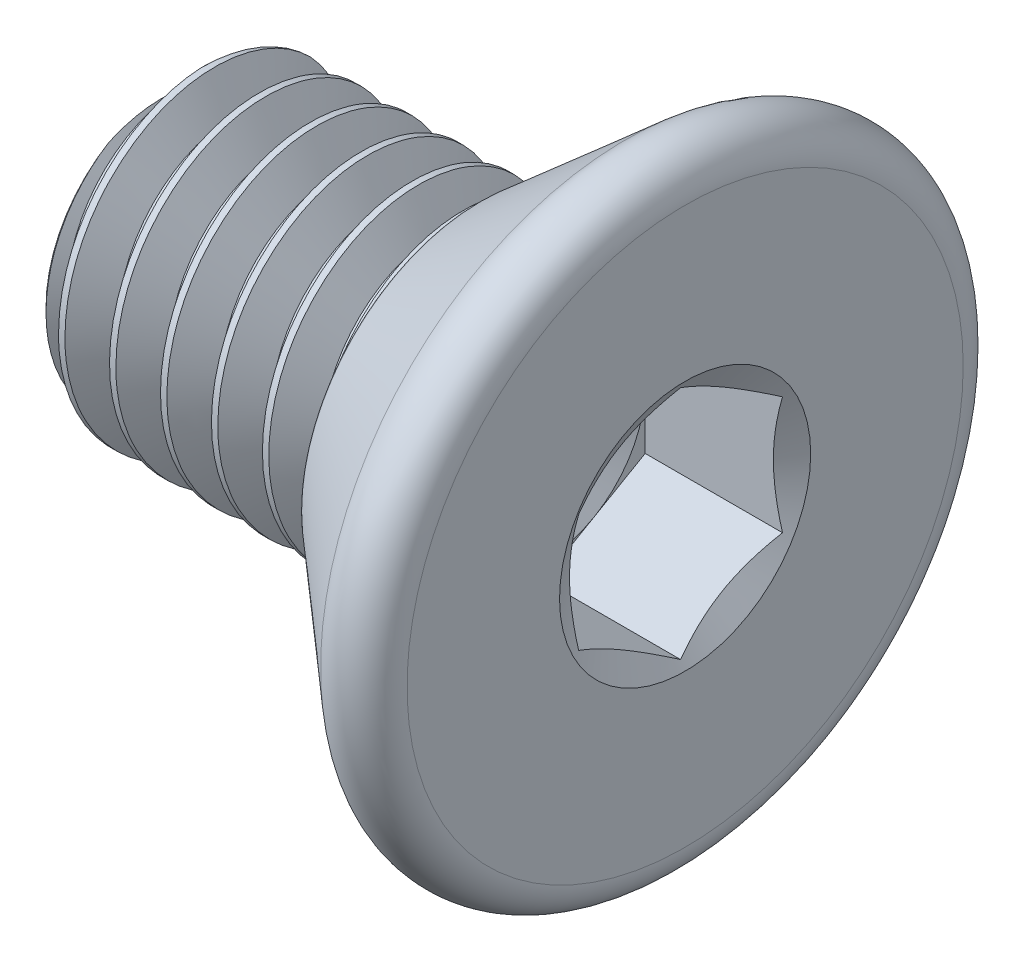
from build123d import *

# Parameters (mm, degrees)
CUT_EXTRUDE1_DEPTH = 2.2098
CUT_SWEEP1_PITCH   = 0.79375
CUT_SWEEP1_TO      = 4.7117


with BuildPart() as part:
    # Sketch3 → Revolve1 (revolve)
    with BuildSketch(Plane.XY, mode=Mode.PRIVATE) as revolve1_sk:
        with BuildLine():
            Line((-3.571875, 2.413), (-3.96875, 2.016125))
            Line((-3.96875, 2.016125), (-3.96875, 0))
            Line((-3.96875, 0), (3.96875, 0))
            Line((3.96875, 0), (3.96875, 4.330768235))
            ThreePointArc((3.96875, 4.330768235), (3.641720522, 4.839192502), (3.043457216, 4.752448451))
            Line((3.043457216, 4.752448451), (0.790519991, 2.794))
            ThreePointArc((0.790519991, 2.794), (0.75540313, 2.74697282), (0.74295, 2.689617182))
            Line((0.74295, 2.689617182), (0.74295, 2.551308591))
            ThreePointArc((0.74295, 2.551308591), (0.702440352, 2.453509648), (0.604641409, 2.413))
            Line((0.604641409, 2.413), (-3.571875, 2.413))
        make_face()
    revolve(revolve1_sk.sketch.rotate(Axis((3.96875, 0, 0), (-1, 0, 0)), 90), axis=Axis((3.96875, 0, 0), (-1, 0, 0)))

    # Sketch4 → Cut-Extrude1 (cut)
    with BuildSketch(Plane(origin=(3.96875, 0, 0), x_dir=(0, 0, -1), z_dir=(1, 0, 0))):
        Polygon((0, 1.833087105), (-1.5875, 0.916543552), (-1.5875, -0.916543552), (0, -1.833087105), (1.5875, -0.916543552), (1.5875, 0.916543552), align=None)
    extrude(amount=-CUT_EXTRUDE1_DEPTH, mode=Mode.SUBTRACT)

    # Cut-Extrude2 cone 1 section (through the dimple's axis) → Cut-Extrude2 (revolve, cut)
    with BuildSketch(Plane(origin=(3.96875, 0, 0), x_dir=(0, 0, -1), z_dir=(0, 1, 0))):
        Polygon((0, 0), (1.955880657, 0), (0, 1.129228224), align=None)
    revolve(axis=Axis((3.96875, 0, 0), (-1, 0, 0)), mode=Mode.SUBTRACT)

    # Cut-Extrude3 cone 1 section (through the dimple's axis) → Cut-Extrude3 (revolve, cut)
    with BuildSketch(Plane(origin=(1.75895, 0, 0), x_dir=(0, 0, -1), z_dir=(0, 1, 0))):
        Polygon((0, 0), (1.5875, 0), (0, 0.916543552), align=None)
    revolve(axis=Axis((1.75895, 0, 0), (-1, 0, 0)), mode=Mode.SUBTRACT)


with BuildPart() as body_2:
    # Split1: read off the stored shape, not the designer's step
    # Split1: the piece on the far side of the plane
    add(part.part)
    split(bisect_by=Plane.YZ.offset(0.74295), keep=Keep.BOTTOM)

    # Cut-Sweep1: arcs per turn and ends read off the stored shape
    # Cut-Sweep1: the profile of Sketch7 screwed along a right-hand helix through 10 turns, 8 arcs to a turn; built about Z, then put on its axis
    cut_sweep1_z = Axis((0, 0, 0), (0, 0, 1))
    cut_sweep1_corners = [(1.897444252, 0, -0.396875), (2.455962979, 0, -0.719335937), (2.455962979, 0, 0.024804688), (1.897444252, 0, -0.29765625)]
    with BuildLine(mode=Mode.PRIVATE) as cut_sweep1_profile:
        Line(cut_sweep1_corners[0], cut_sweep1_corners[1])
        Line(cut_sweep1_corners[1], cut_sweep1_corners[2])
        Line(cut_sweep1_corners[2], cut_sweep1_corners[3])
        Line(cut_sweep1_corners[3], cut_sweep1_corners[0])
    cut_sweep1_cap = Face(cut_sweep1_profile.wire())
    cut_sweep1_turn_angles = [0, 22.5, 45, 67.5, 90, 112.5, 135, 157.5, 180, 202.5, 225, 247.5, 270, 292.5, 315, 337.5, 360]
    cut_sweep1_turn_weights = [1, 0.9238795325112867, 1, 0.9238795325112867, 1, 0.9238795325112867, 1, 0.9238795325112867, 1, 0.9238795325112867, 1, 0.9238795325112867, 1, 0.9238795325112867, 1, 0.9238795325112867, 1]
    cut_sweep1_turn_rails = [Edge.make_bspline([Vector(p[0], p[1], 0).rotate(cut_sweep1_z, cut_sweep1_turn_angles[k]) / cut_sweep1_turn_weights[k] + Vector(0, 0, p[2] + CUT_SWEEP1_PITCH * cut_sweep1_turn_angles[k] / 360) for k in range(17)], [0, 0, 0, 1, 1, 2, 2, 3, 3, 4, 4, 5, 5, 6, 6, 7, 7, 8, 8, 8], 2, cut_sweep1_turn_weights) for p in cut_sweep1_corners]
    cut_sweep1_turn_sides = [Face.make_surface_from_curves(cut_sweep1_turn_rails[p[0]], cut_sweep1_turn_rails[p[1]]) for p in [(0, 1), (1, 2), (2, 3), (3, 0)]]
    cut_sweep1 = Plane(origin=(-3.96875, 0, 0), x_dir=(0, -1, 0), z_dir=(1, 0, 0)) * split(Solid(Shell([*[p.moved(Location((0, 0, CUT_SWEEP1_PITCH * i))) for i in range(10) for p in cut_sweep1_turn_sides], cut_sweep1_cap, cut_sweep1_cap.rotate(cut_sweep1_z, 3600).moved(Location((0, 0, CUT_SWEEP1_PITCH * 3600 / 360)))])), bisect_by=Plane.XY.offset(CUT_SWEEP1_TO), keep=Keep.BOTTOM, mode=Mode.PRIVATE)
    add(cut_sweep1, mode=Mode.SUBTRACT)


with BuildPart() as part_1:
    add(part.part)

    # Split1
    split(bisect_by=Plane.YZ.offset(0.74295), keep=Keep.TOP)


with BuildPart() as body_2_1:
    add(body_2.part)

    # Combine1: union part
    add(part_1.part)


solid = body_2_1.part
